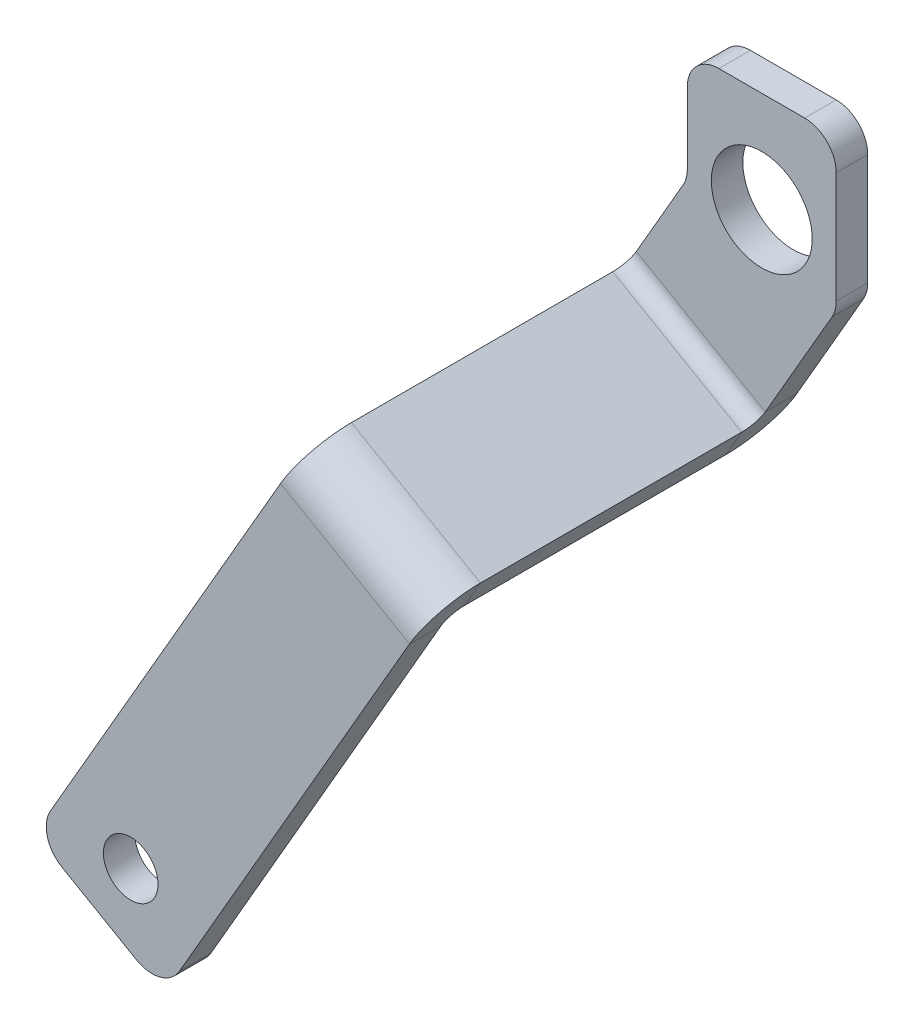
from build123d import *

# Parameters (mm, degrees)
BASE_FLANGE1_DEPTH   = 3.175
EDGE_FLANGE1_DEPTH   = 15
EDGE_FLANGE2_DEPTH   = 15
SKETCH15_R           = 5.08
BOSS_EXTRUDE1_DEPTH  = 3.175
M5_CLEARANCE_HOLE1_D = 5.5
FILLET1_R            = 3.175


# Sheet-metal steps are written as plain solids
with BuildPart() as part:
    # Sketch2 → Base-Flange1 (new body)
    with BuildSketch(Plane.XY):
        Polygon((-136.862074611, 27.127820722), (-140.037074611, 21.628559408), (-153.027455668, 29.128559408), (-149.852455668, 34.627820722), (-128.262455668, 72.022797657), (-115.272074611, 64.522797657), align=None)
    extrude(amount=BASE_FLANGE1_DEPTH)

    # Edge-Flange1 section (across the edge) → Edge-Flange1 (add)
    with BuildSketch(Plane(origin=(-127.468705668, 73.397612986, 0), x_dir=(-0.49999999999999706, -0.8660254037844404, -3.491481338843133e-15), z_dir=(0.8660254037844404, -0.49999999999999706, 0))):
        with BuildLine():
            Line((-3.175, 1.5875), (-3.175, 27.899995))
            Line((-3.175, 27.899995), (0, 27.899995))
            Line((0, 27.899995), (0, 1.5875))
            ThreePointArc((0, 1.5875), (0.464967985, 0.464967985), (1.5875, 0))
            Line((1.5875, 0), (1.5875, -3.175))
            ThreePointArc((1.5875, -3.175), (-1.780096045, -1.780096045), (-3.175, 1.5875))
        make_face()
    extrude(amount=EDGE_FLANGE1_DEPTH)

    # Edge-Flange2 section (across the edge) → Edge-Flange2 (add)
    with BuildSketch(Plane(origin=(-112.890824611, 68.647243643, -29.487495), x_dir=(0, 0, 1), z_dir=(-0.8660254037844405, 0.4999999999999967, 0))):
        with BuildLine():
            Line((-3.175, 1.5875), (-3.175, 6.35))
            Line((-3.175, 6.35), (0, 6.35))
            Line((0, 6.35), (0, 1.5875))
            ThreePointArc((0, 1.5875), (0.464967985, 0.464967985), (1.5875, 0))
            Line((1.5875, 0), (1.5875, -3.175))
            ThreePointArc((1.5875, -3.175), (-1.780096045, -1.780096045), (-3.175, 1.5875))
        make_face()
    extrude(amount=EDGE_FLANGE2_DEPTH)

    # Sketch15 → Boss-Extrude1 (add)
    with BuildSketch(Plane(origin=(0, 0, -32.662495), x_dir=(-1, 0, 0), z_dir=(0, 0, -1))):
        Polygon((122.706205668, 81.646504957), (109.715824611, 74.146504957), (104.953324611, 82.395396928), (104.953324611, 97.635396928), (119.953324611, 97.635396928), (119.953324611, 86.414634815), align=None)
        with Locations((112.453324611, 87.475396928)):
            Circle(SKETCH15_R, mode=Mode.SUBTRACT)
    extrude(amount=-BOSS_EXTRUDE1_DEPTH)

    # M5 Clearance Hole1 (through all)
    with Locations(Plane.XY.offset(3.175)):
        with Locations((-143.35726514, 30.877820722)):
            Hole(M5_CLEARANCE_HOLE1_D / 2)

    # Fillet1
    fillet1_edges = [part.edges().sort_by_distance(p)[0] for p in [
        (-140.037074611, 21.628559408, 1.5875),
        (-153.027455668, 29.128559408, 1.5875),
        (-119.953324611, 86.414634815, -31.074995),
        (-104.953324611, 82.395396928, -31.074995),
        (-104.953324611, 97.635396928, -31.074995),
        (-119.953324611, 97.635396928, -31.074995),
    ]]
    fillet(fillet1_edges, radius=FILLET1_R)


solid = part.part
